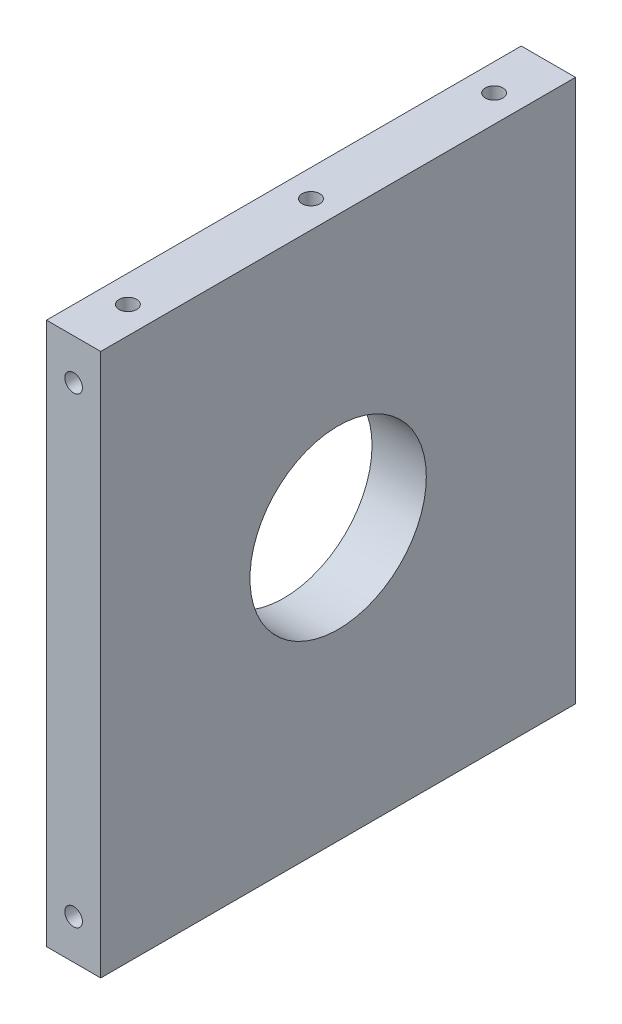
from build123d import *

# Parameters (mm, degrees)
SKETCH_1_W          = 70
SKETCH_1_H          = 80
EXTRUDE_1_DEPTH     = 8
SKETCH_4_R          = 13
CUT_EXTRUDE_2_DEPTH = 8
SKETCH_5_R          = 1.3
CUT_EXTRUDE_3_DEPTH = 10
SKETCH_6_R          = 1.3
CUT_EXTRUDE_4_DEPTH = 10


with BuildPart() as part:
    # 草图1 → 凸台-拉伸1 (new body)
    with BuildSketch(Plane(origin=(0, 0, 0), x_dir=(0, 0, -1), z_dir=(1, 0, 0))):
        Rectangle(SKETCH_1_W, SKETCH_1_H)
    extrude(amount=EXTRUDE_1_DEPTH)

    # 草图4 → 切除-拉伸2 (cut)
    with BuildSketch(Plane(origin=(8, 0, 0), x_dir=(0, 0, -1), z_dir=(1, 0, 0))):
        Circle(SKETCH_4_R)
    extrude(amount=-CUT_EXTRUDE_2_DEPTH, mode=Mode.SUBTRACT)

    # 草图5 → 切除-拉伸3 (cut)
    with BuildSketch(Plane.XY.offset(35)):
        with Locations((4, 34)):
            Circle(SKETCH_5_R)
        with Locations((4, -34.156756408)):
            Circle(SKETCH_5_R)
    cut_extrude_3 = extrude(amount=-CUT_EXTRUDE_3_DEPTH, mode=Mode.SUBTRACT)

    # 镜向1: 切除-拉伸3 across plane
    add(cut_extrude_3.mirror(Plane.XY), mode=Mode.SUBTRACT)

    # 草图6 → 切除-拉伸4 (cut)
    with BuildSketch(Plane(origin=(0, 40, 0), x_dir=(1, 0, 0), z_dir=(0, 1, 0))):
        with Locations((4, 27)):
            Circle(SKETCH_6_R)
        with Locations((4, -27)):
            Circle(SKETCH_6_R)
        with Locations((4, 0)):
            Circle(SKETCH_6_R)
    cut_extrude_4 = extrude(amount=-CUT_EXTRUDE_4_DEPTH, mode=Mode.SUBTRACT)

    # 镜向2: 切除-拉伸4 across plane
    add(cut_extrude_4.mirror(Plane.ZX), mode=Mode.SUBTRACT)


solid = part.part
